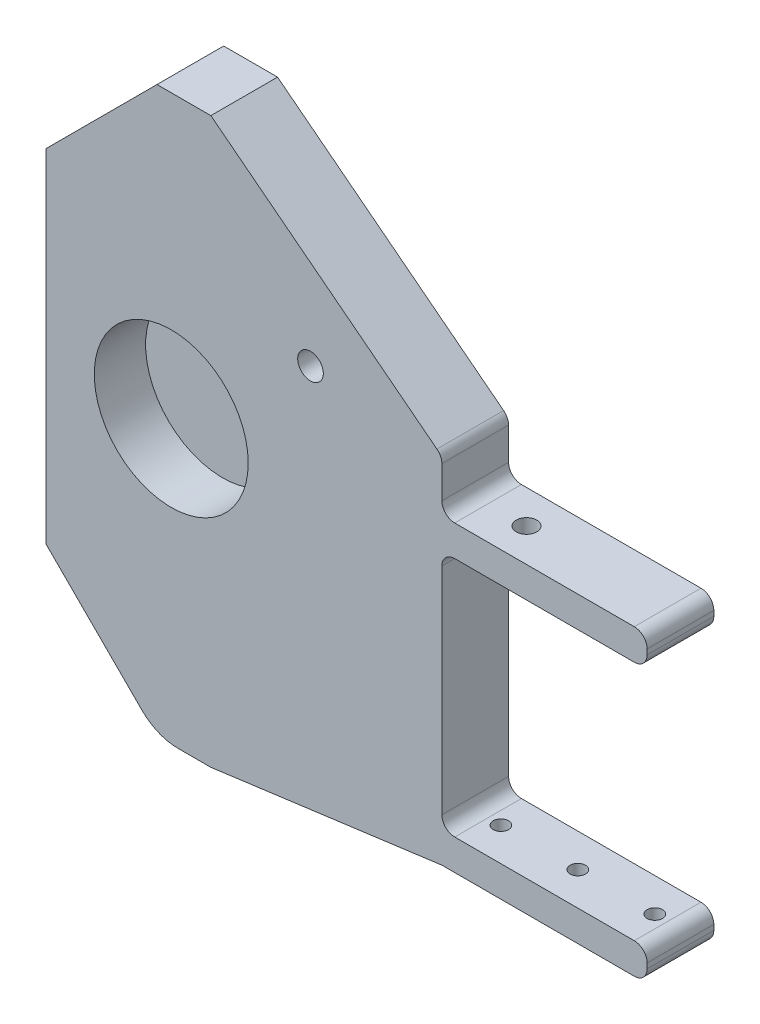
from build123d import *

# Parameters (mm, degrees)
RESSALTO_EXTRUS_O1_DEPTH = 6.5
ESBO_O2_R                = 15
CORTE_EXTRUS_O1_DEPTH    = 10
ESBO_O3_R                = 2.5
CORTE_EXTRUS_O2_DEPTH    = 13
FILETE1_R                = 10
ESBO_O4_R                = 2
CORTE_EXTRUS_O3_DEPTH    = 10
ESBO_O6_R                = 2
CORTE_EXTRUS_O4_DEPTH    = 10
ESBO_O7_R                = 1.5
CORTE_EXTRUS_O5_DEPTH    = 10
FILETE2_R                = 2.5


with BuildPart() as part:
    # Esboço1 → Ressalto-extrusão1 (new, symmetric)
    with BuildSketch(Plane.XY):
        Polygon((32.742040246, 55), (4.980147158, 55), (-22.781745931, 55), (-44.375431078, 33.406314852), (-44.375431078, -33.406314852), (-22.781745931, -55), (32.742040246, -55), (32.742040246, -49), (72.742040246, -49), (72.742040246, -43), (32.742040246, -43), (32.742040246, 4), (72.742040246, 4), (72.742040246, 10), (32.742040246, 10), align=None)
    extrude(amount=RESSALTO_EXTRUS_O1_DEPTH, both=True)

    # Esboço2 → Corte-extrusão1 (cut)
    with BuildSketch(Plane.XY.offset(6.5)):
        with Locations((-20, 0)):
            Circle(ESBO_O2_R)
    extrude(amount=-CORTE_EXTRUS_O1_DEPTH, mode=Mode.SUBTRACT)

    # Esboço3 → Corte-extrusão2 (cut)
    with BuildSketch(Plane.XY.offset(6.5)):
        with Locations((7.14, 22.43)):
            Circle(ESBO_O3_R)
        Polygon((-12.281745931, -55), (32.742040246, -49), (32.742040246, -55), align=None)
        Polygon((32.742040246, 55), (-12.281745931, 55), (32.742040246, 20), align=None)
    extrude(amount=-CORTE_EXTRUS_O2_DEPTH, mode=Mode.SUBTRACT)

    # Filete1
    filete1_edges = [part.edges().sort_by_distance(p)[0] for p in [
        (-22.781745931, -55, 0),
    ]]
    fillet(filete1_edges, radius=FILETE1_R)

    # Esboço4 → Corte-extrusão3 (cut)
    with BuildSketch(Plane(origin=(0, 0, -6.5), x_dir=(-1, 0, 0), z_dir=(0, 0, -1))):
        with Locations((36.375431078, 8.406314852)):
            Circle(ESBO_O4_R)
        with Locations((12.955431078, -16.593685148)):
            Circle(ESBO_O4_R)
        with Locations((22.375431078, -27.593685148)):
            Circle(ESBO_O4_R)
    extrude(amount=-CORTE_EXTRUS_O3_DEPTH, mode=Mode.SUBTRACT)

    # Esboço6 → Corte-extrusão4 (cut)
    with BuildSketch(Plane(origin=(0, 10, 0), x_dir=(1, 0, 0), z_dir=(0, 1, 0))):
        with Locations((42.742040246, -0.001621735)):
            Circle(ESBO_O6_R)
    extrude(amount=-CORTE_EXTRUS_O4_DEPTH, mode=Mode.SUBTRACT)

    # Esboço7 → Corte-extrusão5 (cut)
    with BuildSketch(Plane.XZ.offset(49)):
        with Locations((37.742040246, 0)):
            Circle(ESBO_O7_R)
        with Locations((52.742040246, 0)):
            Circle(ESBO_O7_R)
        with Locations((67.742040246, 0)):
            Circle(ESBO_O7_R)
    extrude(amount=-CORTE_EXTRUS_O5_DEPTH, mode=Mode.SUBTRACT)

    # Filete2
    filete2_edges = [part.edges().sort_by_distance(p)[0] for p in [
        (72.742040246, -49, 0),
        (72.742040246, -43, 0),
        (72.742040246, 4, 0),
        (72.742040246, 10, 0),
        (32.742040246, 20, 0),
        (32.742040246, -43, 0),
        (32.742040246, 10, 0),
        (32.742040246, 4, 0),
    ]]
    fillet(filete2_edges, radius=FILETE2_R)


solid = part.part
